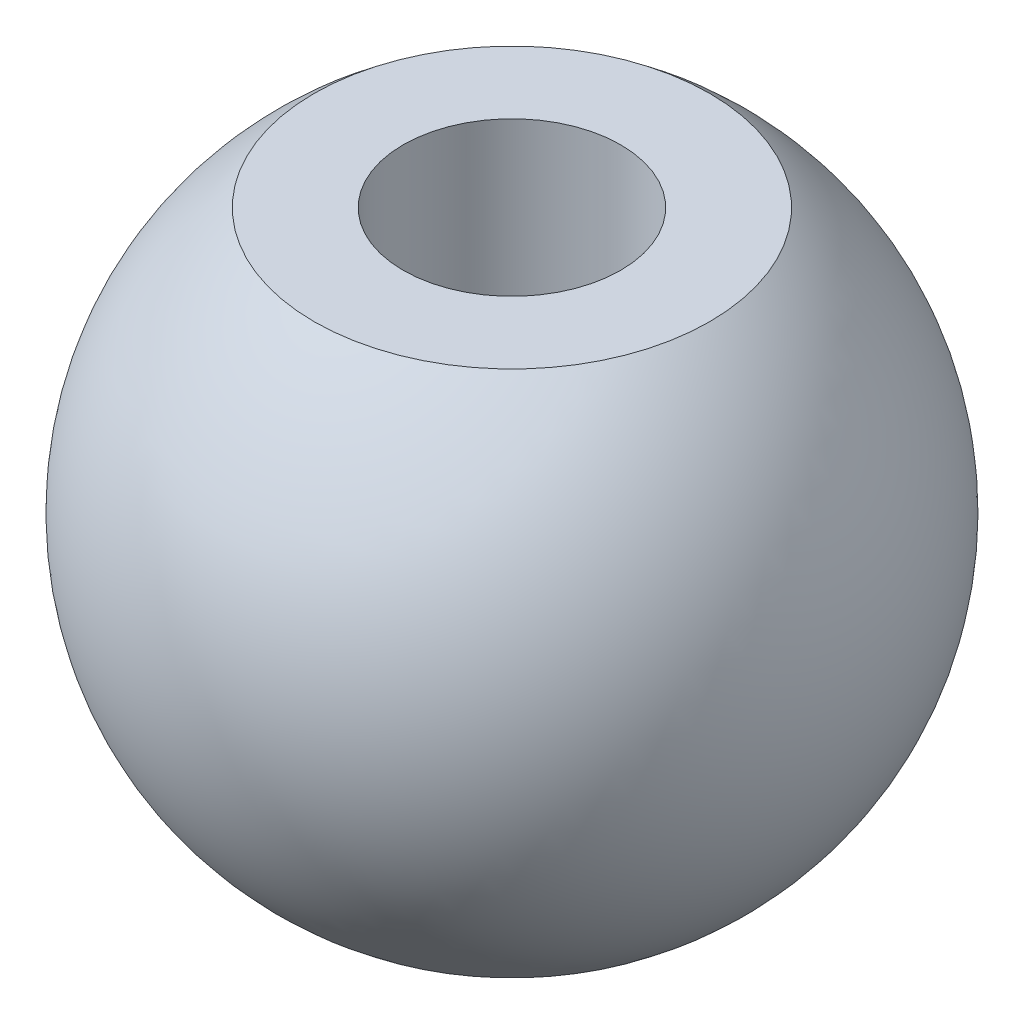
from build123d import *

# Parameters (mm, degrees)
SKETCH1_W           = 70
SKETCH1_H           = 28
BOSS_EXTRUDE1_DEPTH = 8
SKETCH2_W           = 10
SKETCH2_H           = 10
CUT_EXTRUDE1_DEPTH  = 10
SKETCH3_R           = 2.15
CUT_EXTRUDE2_DEPTH  = 46.530209751
SKETCH5_W           = 16.977623655
SKETCH5_H           = 6.5
CUT_EXTRUDE4_DEPTH  = 39.535697736
SKETCH7_R           = 1.65
CUT_EXTRUDE5_DEPTH  = 10


# Read off the part's stored shape, not the designer's step: Cut-Revolve1
with BuildPart() as part:
    # Sketch1 → Boss-Extrude1 (new body)
    with BuildSketch(Plane(origin=(0, 0, 0), x_dir=(1, 0, 0), z_dir=(0, 1, 0))):
        Rectangle(SKETCH1_W, SKETCH1_H)
    extrude(amount=BOSS_EXTRUDE1_DEPTH)

    # Sketch2 → Cut-Extrude1 (cut)
    with BuildSketch(Plane(origin=(0, 8, 0), x_dir=(1, 0, 0), z_dir=(0, 1, 0))):
        with Locations((30, 0)):
            Rectangle(SKETCH2_W, SKETCH2_H)
    extrude(amount=-CUT_EXTRUDE1_DEPTH, mode=Mode.SUBTRACT)

    # Sketch3 → Cut-Extrude2 (cut, through all)
    with BuildSketch(Plane.XY.offset(14)):
        with Locations((31, 4)):
            Circle(SKETCH3_R)
    extrude(amount=-CUT_EXTRUDE2_DEPTH, mode=Mode.SUBTRACT)

    # Sketch5 → Cut-Extrude4 (cut, through all)
    with BuildSketch(Plane(origin=(0, 8, 0), x_dir=(1, 0, 0), z_dir=(0, 1, 0))):
        with Locations((-26.511188172, 10.75)):
            Rectangle(SKETCH5_W, SKETCH5_H)
        Polygon((-18.022376345, 14), (-18.022376345, 7.5), (1.977623655, 14), align=None)
        Polygon((1.977623655, -14), (-18.022376345, -7.5), (-18.022376345, -14), align=None)
        with Locations((-26.511188172, -10.75)):
            Rectangle(SKETCH5_W, SKETCH5_H)
    extrude(amount=-CUT_EXTRUDE4_DEPTH, mode=Mode.SUBTRACT)

    # Cut-Revolve1 outline → Cut-Revolve1 (revolve, cut)
    with BuildSketch(Plane(origin=(0, 4, 0), x_dir=(0, 1, 0), z_dir=(0, 0, -1))):
        with BuildLine():
            Line((0, -35), (8.5, -35))
            Line((8.5, -35), (8.5, -22.5))
            Line((8.5, -22.5), (14.560219779, -22.5))
            Line((14.560219779, -22.5), (14.560219779, 35))
            Line((14.560219779, 35), (0, 35))
            Line((0, 35), (0, -22.5))
            ThreePointArc((0, -22.5), (5, -27.5), (0, -32.5))
            Line((0, -32.5), (0, -35))
        make_face()
    revolve(axis=Axis((0, 4, 0), (1, 0, 0)), mode=Mode.SUBTRACT)

    # Sketch7 → Cut-Extrude5 (cut)
    with BuildSketch(Plane.XZ):
        with Locations(Location((-27.5, 0, 0), (0, 0, 270))):
            Circle(SKETCH7_R)
    extrude(amount=-CUT_EXTRUDE5_DEPTH, mode=Mode.SUBTRACT)


solid = part.part
